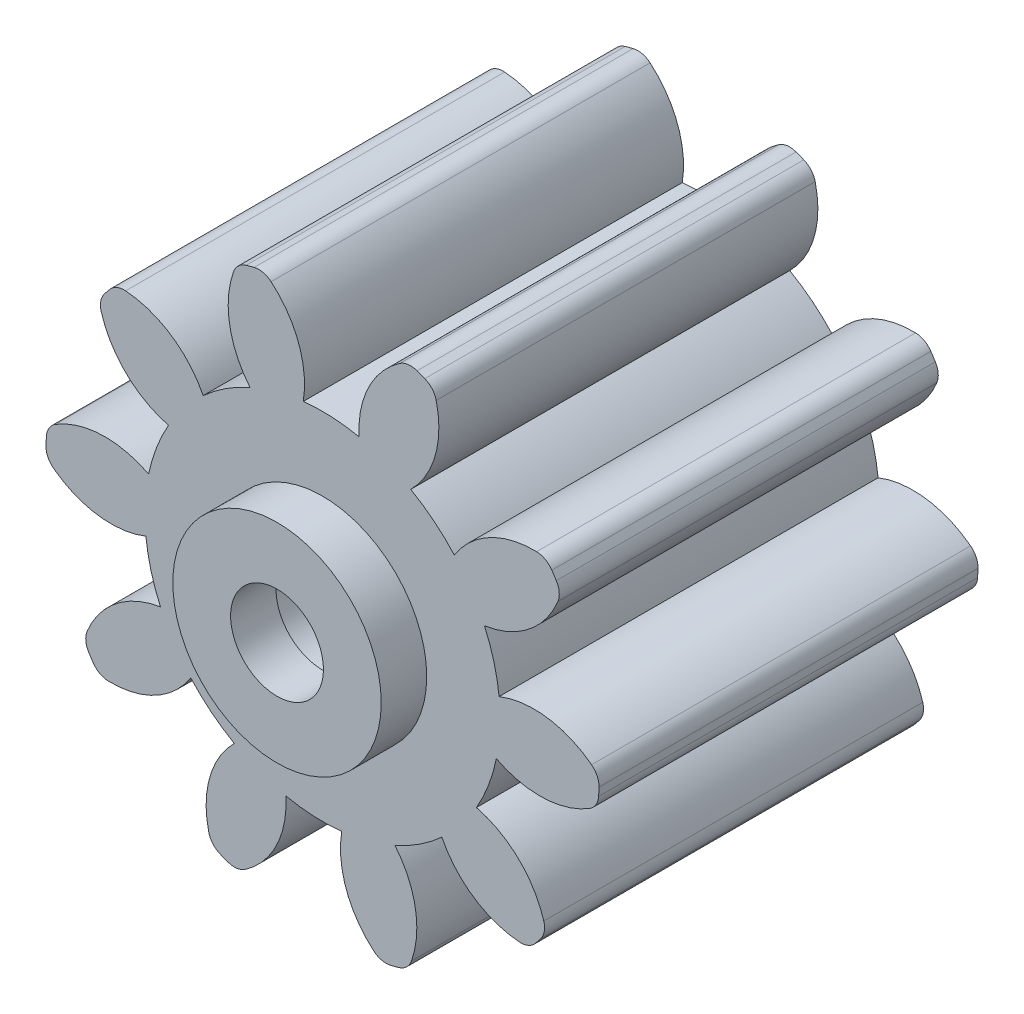
from build123d import *

# Parameters (mm, degrees)
SKETCH_1_R               = 1.265
EXTRUDE_1_DEPTH          = 10
SKETCH_2_R               = 2.75
SKETCH_2_R_2             = 1.225
EXTRUDE_2_DEPTH          = 1.2
SKETCH_3_R               = 10.210079725
SKETCH_3_R_2             = 7.3
CUT_EXTRUDE_2_DEPTH      = 16.316956182
FILLET_1_R               = 0.5
PATTERN_CIRCULAR_2_DEPTH = 10


# Read off the part's stored shape, not the designer's step: Круговой массив2
with BuildPart() as part:
    # Эскиз1 → Бобышка-Вытянуть1 (new body)
    with BuildSketch(Plane.XY):
        with BuildLine():
            ThreePointArc((-3.148803906, 3.471068454), (-4.227852242, 4.566214035), (-5.743712894, 4.822837566))
            ThreePointArc((-5.743712894, 4.822837566), (-5.841480421, 4.703945843), (-5.936787387, 4.583072716))
            ThreePointArc((-5.936787387, 4.583072716), (-5.362797198, 3.156810321), (-4.062728379, 2.336133637))
            ThreePointArc((-4.062728379, 2.336133637), (-4.379801209, 1.667520202), (-4.587678719, 0.95733287))
            ThreePointArc((-4.587678719, 0.95733287), (-6.104357582, 1.209075557), (-7.481554138, 0.525687819))
            ThreePointArc((-7.481554138, 0.525687819), (-7.490766927, 0.372036085), (-7.496824441, 0.218227641))
            ThreePointArc((-7.496824441, 0.218227641), (-6.194120622, -0.598259906), (-4.659961201, -0.498040012))
            ThreePointArc((-4.659961201, -0.498040012), (-4.523477392, -1.225330377), (-4.274216191, -1.922071332))
            ThreePointArc((-4.274216191, -1.922071332), (-5.649205805, -2.609888688), (-6.361695989, -3.972256807))
            ThreePointArc((-6.361695989, -3.972256807), (-6.278835069, -4.101978813), (-6.193329365, -4.229972975))
            ThreePointArc((-6.193329365, -4.229972975), (-4.659500498, -4.124815183), (-3.477247231, -3.141979304))
            ThreePointArc((-3.477247231, -3.141979304), (-2.939338959, -3.650146399), (-2.328148353, -4.067309614))
            ThreePointArc((-2.328148353, -4.067309614), (-3.03624942, -5.431964161), (-2.811886199, -6.952934345))
            ThreePointArc((-2.811886199, -6.952934345), (-2.668601624, -7.009177225), (-2.524192976, -7.062467686))
            ThreePointArc((-2.524192976, -7.062467686), (-1.345109555, -6.075831258), (-0.966343005, -4.585789294))
            ThreePointArc((-0.966343005, -4.585789294), (-0.232472948, -4.68073056), (0.507193024, -4.658973866))
            ThreePointArc((0.507193024, -4.658973866), (0.736451045, -6.179213951), (1.811968547, -7.277827285))
            ThreePointArc((1.811968547, -7.277827285), (1.960946938, -7.239108171), (2.109099336, -7.197339786))
            ThreePointArc((2.109099336, -7.197339786), (2.483067519, -5.706086302), (1.913671403, -4.277983638))
            ThreePointArc((1.913671403, -4.277983638), (2.563189827, -3.92343474), (3.148803906, -3.471068454))
            ThreePointArc((3.148803906, -3.471068454), (4.227852242, -4.566214035), (5.743712894, -4.822837566))
            ThreePointArc((5.743712894, -4.822837566), (5.841480421, -4.703945843), (5.936787387, -4.583072716))
            ThreePointArc((5.936787387, -4.583072716), (5.362797198, -3.156810321), (4.062728379, -2.336133637))
            ThreePointArc((4.062728379, -2.336133637), (4.379801209, -1.667520202), (4.587678719, -0.95733287))
            ThreePointArc((4.587678719, -0.95733287), (6.104357582, -1.209075557), (7.481554138, -0.525687819))
            ThreePointArc((7.481554138, -0.525687819), (7.490766927, -0.372036085), (7.496824441, -0.218227641))
            ThreePointArc((7.496824441, -0.218227641), (6.194120622, 0.598259906), (4.659961201, 0.498040012))
            ThreePointArc((4.659961201, 0.498040012), (4.523477392, 1.225330377), (4.274216191, 1.922071332))
            ThreePointArc((4.274216191, 1.922071332), (5.649205805, 2.609888688), (6.361695989, 3.972256807))
            ThreePointArc((6.361695989, 3.972256807), (6.278835069, 4.101978813), (6.193329365, 4.229972975))
            ThreePointArc((6.193329365, 4.229972975), (4.659500498, 4.124815183), (3.477247231, 3.141979304))
            ThreePointArc((3.477247231, 3.141979304), (2.939338959, 3.650146399), (2.328148353, 4.067309614))
            ThreePointArc((2.328148353, 4.067309614), (3.03624942, 5.431964161), (2.811886199, 6.952934345))
            ThreePointArc((2.811886199, 6.952934345), (2.668601624, 7.009177225), (2.524192976, 7.062467686))
            ThreePointArc((2.524192976, 7.062467686), (1.345109555, 6.075831258), (0.966343005, 4.585789294))
            ThreePointArc((0.966343005, 4.585789294), (0.232472948, 4.68073056), (-0.507193024, 4.658973866))
            ThreePointArc((-0.507193024, 4.658973866), (-0.736451045, 6.179213951), (-1.811968547, 7.277827285))
            ThreePointArc((-1.811968547, 7.277827285), (-1.960946938, 7.239108171), (-2.109099336, 7.197339786))
            ThreePointArc((-2.109099336, 7.197339786), (-2.483067519, 5.706086302), (-1.913671403, 4.277983638))
            ThreePointArc((-1.913671403, 4.277983638), (-2.563189827, 3.92343474), (-3.148803906, 3.471068454))
        make_face()
        Circle(SKETCH_1_R, mode=Mode.SUBTRACT)
    extrude(amount=EXTRUDE_1_DEPTH)

    # Эскиз2 → Бобышка-Вытянуть2 (add)
    with BuildSketch(Plane.XY.offset(10)):
        Circle(SKETCH_2_R)
        Circle(SKETCH_2_R_2, mode=Mode.SUBTRACT)
    extrude(amount=EXTRUDE_2_DEPTH)

    # Эскиз3 → Вырез-Вытянуть2 (cut, through all)
    with BuildSketch(Plane(origin=(0, 0, 0), x_dir=(-1, 0, 0), z_dir=(0, 0, -1))):
        Circle(SKETCH_3_R)
        Circle(SKETCH_3_R_2, mode=Mode.SUBTRACT)
    extrude(amount=-CUT_EXTRUDE_2_DEPTH, mode=Mode.SUBTRACT)

    # Скругление1
    fillet_1_edges = [part.edges().sort_by_distance(p)[0] for p in [
        (-2.246892365, 6.945608303, 5),
        (-1.565958675, 7.13006125, 5),
    ]]
    fillet(fillet_1_edges, radius=FILLET_1_R)

    # Круговой массив2 outline → Круговой массив2 (cut)
    with BuildSketch(Plane.XY):
        with BuildLine():
            ThreePointArc((-5.838293306, 4.042408612), (-5.850561559, 4.278183981), (-5.753278974, 4.493304024))
            ThreePointArc((-5.753278974, 4.493304024), (-5.827604273, 4.396479095), (-5.900300237, 4.298424958))
            ThreePointArc((-5.900300237, 4.298424958), (-5.872671085, 4.169599529), (-5.838293306, 4.042408612))
        make_face()
        with BuildLine():
            ThreePointArc((-5.457832031, 4.847893307), (-5.538127486, 4.755958783), (-5.61687454, 4.662694543))
            ThreePointArc((-5.61687454, 4.662694543), (-5.427449488, 4.803615386), (-5.19448163, 4.841910441))
            ThreePointArc((-5.19448163, 4.841910441), (-5.326077976, 4.84837285), (-5.457832031, 4.847893307))
        make_face()
        with BuildLine():
            ThreePointArc((-7.099346669, -0.161285439), (-7.247857179, 0.022249743), (-7.295598302, 0.253466783))
            ThreePointArc((-7.295598302, 0.253466783), (-7.298816468, 0.131446456), (-7.299993962, 0.009389377))
            ThreePointArc((-7.299993962, 0.009389377), (-7.201919821, -0.078592576), (-7.099346669, -0.161285439))
        make_face()
        with BuildLine():
            ThreePointArc((-7.264999056, 0.713994895), (-7.275921686, 0.592421818), (-7.284810046, 0.470683106))
            ThreePointArc((-7.284810046, 0.470683106), (-7.214393154, 0.696031715), (-7.048427465, 0.863948137))
            ThreePointArc((-7.048427465, 0.863948137), (-7.158689654, 0.791825944), (-7.264999056, 0.713994895))
        make_face()
        with BuildLine():
            ThreePointArc((-5.648690902, -4.303373934), (-5.876717701, -4.24218314), (-6.051247048, -4.083186154))
            ThreePointArc((-6.051247048, -4.083186154), (-5.982128849, -4.183794263), (-5.911338111, -4.283232627))
            ThreePointArc((-5.911338111, -4.283232627), (-5.78027997, -4.296764989), (-5.648690902, -4.303373934))
        make_face()
        with BuildLine():
            ThreePointArc((-6.29718337, -3.692625299), (-6.234561102, -3.797400146), (-6.170195716, -3.90111328))
            ThreePointArc((-6.170195716, -3.90111328), (-6.245683843, -3.677412414), (-6.210113576, -3.444012991))
            ThreePointArc((-6.210113576, -3.444012991), (-6.2569252, -3.567171559), (-6.29718337, -3.692625299))
        make_face()
        with BuildLine():
            ThreePointArc((-2.040427202, -6.801719852), (-2.260871804, -6.88624625), (-2.495525095, -6.860200762))
            ThreePointArc((-2.495525095, -6.860200762), (-2.380471335, -6.900967774), (-2.264752021, -6.939805349))
            ThreePointArc((-2.264752021, -6.939805349), (-2.150769635, -6.873719217), (-2.040427202, -6.801719852))
        make_face()
        with BuildLine():
            ThreePointArc((-2.92405767, -6.688788137), (-2.811810081, -6.736744322), (-2.69877634, -6.782816986))
            ThreePointArc((-2.69877634, -6.782816986), (-2.891335587, -6.646209992), (-2.999747375, -6.436478214))
            ThreePointArc((-2.999747375, -6.436478214), (-2.965227985, -6.563630771), (-2.92405767, -6.688788137))
        make_face()
        with BuildLine():
            ThreePointArc((2.347210337, -6.702039969), (2.218550278, -6.899997348), (2.013402624, -7.016851849))
            ThreePointArc((2.013402624, -7.016851849), (2.130445319, -6.982206151), (2.246892365, -6.945608303))
            ThreePointArc((2.246892365, -6.945608303), (2.300261598, -6.825146334), (2.347210337, -6.702039969))
        make_face()
        with BuildLine():
            ThreePointArc((1.565958675, -7.13006125), (1.684956821, -7.102881142), (1.80348387, -7.073715143))
            ThreePointArc((1.80348387, -7.073715143), (1.56740459, -7.076381249), (1.356420365, -6.970427527))
            ThreePointArc((1.356420365, -6.970427527), (1.459085537, -7.053006118), (1.565958675, -7.13006125))
        make_face()
        with BuildLine():
            ThreePointArc((5.838293306, -4.042408612), (5.850561559, -4.278183981), (5.753278974, -4.493304024))
            ThreePointArc((5.753278974, -4.493304024), (5.827604273, -4.396479095), (5.900300237, -4.298424958))
            ThreePointArc((5.900300237, -4.298424958), (5.872671085, -4.169599529), (5.838293306, -4.042408612))
        make_face()
        with BuildLine():
            ThreePointArc((5.457832031, -4.847893307), (5.538127486, -4.755958783), (5.61687454, -4.662694543))
            ThreePointArc((5.61687454, -4.662694543), (5.427449488, -4.803615386), (5.19448163, -4.841910441))
            ThreePointArc((5.19448163, -4.841910441), (5.326077976, -4.84837285), (5.457832031, -4.847893307))
        make_face()
        with BuildLine():
            ThreePointArc((7.099346669, 0.161285439), (7.247857179, -0.022249743), (7.295598302, -0.253466783))
            ThreePointArc((7.295598302, -0.253466783), (7.298816468, -0.131446456), (7.299993962, -0.009389377))
            ThreePointArc((7.299993962, -0.009389377), (7.201919821, 0.078592576), (7.099346669, 0.161285439))
        make_face()
        with BuildLine():
            ThreePointArc((7.264999056, -0.713994895), (7.275921686, -0.592421818), (7.284810046, -0.470683106))
            ThreePointArc((7.284810046, -0.470683106), (7.214393154, -0.696031715), (7.048427465, -0.863948137))
            ThreePointArc((7.048427465, -0.863948137), (7.158689654, -0.791825944), (7.264999056, -0.713994895))
        make_face()
        with BuildLine():
            ThreePointArc((5.648690902, 4.303373934), (5.876717701, 4.24218314), (6.051247048, 4.083186154))
            ThreePointArc((6.051247048, 4.083186154), (5.982128849, 4.183794263), (5.911338111, 4.283232627))
            ThreePointArc((5.911338111, 4.283232627), (5.78027997, 4.296764989), (5.648690902, 4.303373934))
        make_face()
        with BuildLine():
            ThreePointArc((6.29718337, 3.692625299), (6.234561102, 3.797400146), (6.170195716, 3.90111328))
            ThreePointArc((6.170195716, 3.90111328), (6.245683843, 3.677412414), (6.210113576, 3.444012991))
            ThreePointArc((6.210113576, 3.444012991), (6.2569252, 3.567171559), (6.29718337, 3.692625299))
        make_face()
        with BuildLine():
            ThreePointArc((2.040427202, 6.801719852), (2.260871804, 6.88624625), (2.495525095, 6.860200762))
            ThreePointArc((2.495525095, 6.860200762), (2.380471335, 6.900967774), (2.264752021, 6.939805349))
            ThreePointArc((2.264752021, 6.939805349), (2.150769635, 6.873719217), (2.040427202, 6.801719852))
        make_face()
        with BuildLine():
            ThreePointArc((2.92405767, 6.688788137), (2.811810081, 6.736744322), (2.69877634, 6.782816986))
            ThreePointArc((2.69877634, 6.782816986), (2.891335587, 6.646209992), (2.999747375, 6.436478214))
            ThreePointArc((2.999747375, 6.436478214), (2.965227985, 6.563630771), (2.92405767, 6.688788137))
        make_face()
    extrude(amount=PATTERN_CIRCULAR_2_DEPTH, mode=Mode.SUBTRACT)


solid = part.part
